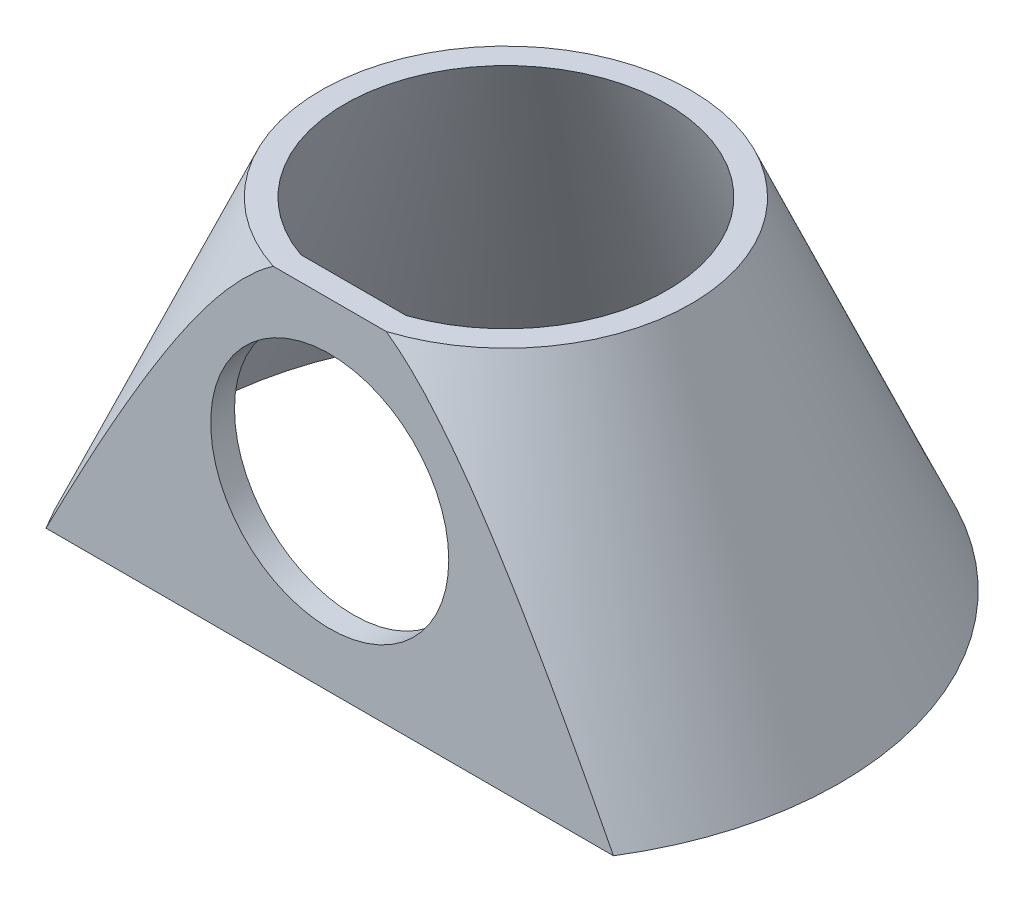
from build123d import *

# Parameters (mm, degrees)
CUT_EXTRUDE1_DEPTH      = 26.89826249
CUT_EXTRUDE1_DEPTH_BACK = 26.89826249
SKETCH4_W               = 44.770884432
SKETCH4_H               = 10.69042287
SKETCH6_W               = 24.706274506
SKETCH6_H               = 1
BOSS_EXTRUDE1_DEPTH     = 16
SKETCH8_W               = 44.013591964
SKETCH8_H               = 26.255140404
CUT_EXTRUDE2_DEPTH      = 0.85
SKETCH9_W               = 50.816359418
SKETCH9_H               = 30.548951937
CUT_EXTRUDE3_DEPTH      = 0.85
CUT_EXTRUDE4_REACH      = 30.485
SKETCH10_R              = 5


with BuildPart() as part:
    # Sketch3 → Revolve1 (revolve)
    with BuildSketch(Plane.XY):
        Polygon((-6.4, 13.316712654), (-7.4, 13.316712654), (-14.4, -2.683287346), (-13.4, -2.683287346), align=None)
    revolve(axis=Axis((0, 50, 0), (0, -1, 0)))

    # Sketch4 → Cut-Extrude1 (cut, two sides: drawn at the far end of the back side and taken through both)
    with BuildSketch(Plane(origin=(0, 13.316712654, 0), x_dir=(1, 0, 0), z_dir=(0, 1, 0)).offset(-CUT_EXTRUDE1_DEPTH_BACK)):
        with Locations((0.720276718, -12.745211435)):
            Rectangle(SKETCH4_W, SKETCH4_H)
    extrude(amount=CUT_EXTRUDE1_DEPTH + CUT_EXTRUDE1_DEPTH_BACK, mode=Mode.SUBTRACT)

    # Sketch6 → Boss-Extrude1 (add)
    with BuildSketch(Plane.XZ.offset(2.683287346)):
        with Locations((0, 6.9)):
            Rectangle(SKETCH6_W, SKETCH6_H)
    extrude(amount=-BOSS_EXTRUDE1_DEPTH)

    # Sketch7 → Cut-Revolve1 (revolve, cut)
    with BuildSketch(Plane(origin=(0, 0, 0), x_dir=(0, 0, -1), z_dir=(1, 0, 0))):
        Polygon((7.4, 13.316712654), (14.4, -2.683287346), (16.866286124, -2.683287346), (16.866286124, 13.316712654), align=None)
    revolve(axis=Axis((0, 14.930838331, 0), (0, -1, 0)), mode=Mode.SUBTRACT)

    # Sketch8 → Cut-Extrude2 (cut)
    with BuildSketch(Plane(origin=(0, 13.316712654, 0), x_dir=(1, 0, 0), z_dir=(0, 1, 0))):
        with Locations((-2.588663139, 4.329260992)):
            Rectangle(SKETCH8_W, SKETCH8_H)
    extrude(amount=-CUT_EXTRUDE2_DEPTH, mode=Mode.SUBTRACT)

    # Sketch9 → Cut-Extrude3 (cut)
    with BuildSketch(Plane.XZ.offset(2.683287346)):
        with Locations((0.819476292, -3.706436551)):
            Rectangle(SKETCH9_W, SKETCH9_H)
    extrude(amount=-CUT_EXTRUDE3_DEPTH, mode=Mode.SUBTRACT)

    # Sketch10 → Cut-Extrude4 (cut, up to next)
    with BuildSketch(Plane.XY.offset(7.4), mode=Mode.PRIVATE) as cut_extrude4_sk1:
        with Locations((0, 5.466712654)):
            Circle(SKETCH10_R)
    cut_extrude4_tool1 = extrude(cut_extrude4_sk1.sketch, amount=-CUT_EXTRUDE4_REACH, mode=Mode.PRIVATE) & part.part
    add(cut_extrude4_tool1.solids().sort_by_distance((0, 5.466713, 7.4))[0], mode=Mode.SUBTRACT)


solid = part.part
